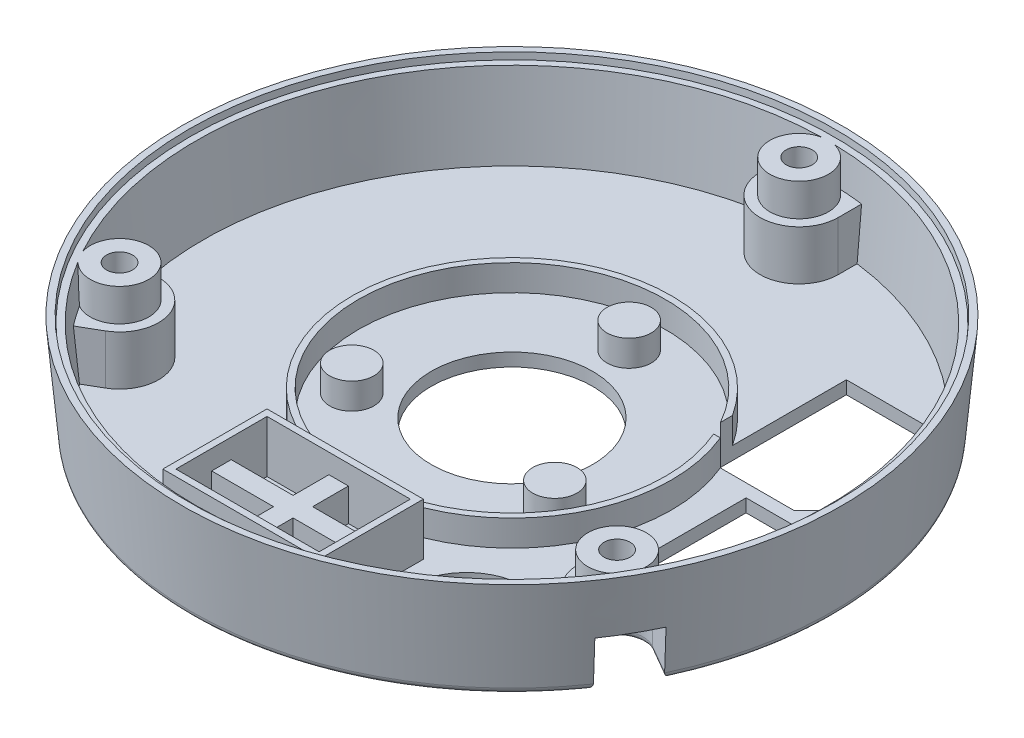
from build123d import *

# Parameters (mm, degrees)
SKETCH_8_R               = 2.25
EXTRUDE_23_DEPTH         = 6.3
EXTRUDE_24_DEPTH         = 3.8
SKETCH_8_5_R             = 1
CUT_EXTRUDE_2_DEPTH      = 37.420049423
PATTERN_CIRCULAR_1_COUNT = 3
CUT_EXTRUDE_3_DEPTH      = 3.7
PATTERN_CIRCULAR_2_COUNT = 3
CUT_EXTRUDE_6_DEPTH      = 1
SKETCH_12_W              = 12
SKETCH_12_H              = 8
SKETCH_12_W_2            = 11
SKETCH_12_H_2            = 7
EXTRUDE_1_DEPTH          = 4
SKETCH_14_R              = 6.2
SKETCH_14_R_2            = 4.5
CUT_EXTRUDE_7_DEPTH      = 1
FILLET_1_R               = 0.5
EXTRUDE_25_DEPTH         = 2.5
EXTRUDE_26_OUTLINE_R     = 1.7
EXTRUDE_26_DEPTH         = 2


# Read off the part's stored shape, not the designer's step: 凸台-拉伸26
with BuildPart() as part:
    # 草图7 → 旋转1 (revolve)
    with BuildSketch(Plane.XY, mode=Mode.PRIVATE) as revolve_1_sk:
        Polygon((0, 0), (24.6, 0), (25.3, 7.8), (24.8, 7.8), (24.755128205, 7.3), (24.255128205, 7.3), (23.68974359, 1), (0, 1), align=None)
    revolve(revolve_1_sk.sketch.rotate(Axis((0, 1, 0), (0, -1, 0)), 180), axis=Axis((0, 1, 0), (0, -1, 0)))

    # 草图8 → 凸台-拉伸23 (add)
    with BuildSketch(Plane(origin=(0, 1, 0), x_dir=(1, 0, 0), z_dir=(0, 1, 0))):
        with Locations((0, 22.05)):
            Circle(SKETCH_8_R)
    extrude_23 = extrude(amount=EXTRUDE_23_DEPTH)

    # 草图8<4> → 凸台-拉伸24 (add)
    with BuildSketch(Plane(origin=(0, 1, 0), x_dir=(1, 0, 0), z_dir=(0, 1, 0))):
        with BuildLine():
            Line((-3, 22.05), (-3, 24.114103757))
            ThreePointArc((-3, 24.114103757), (0, 24.3), (3, 24.114103757))
            Line((3, 24.114103757), (3, 22.05))
            ThreePointArc((3, 22.05), (0, 19.05), (-3, 22.05))
        make_face()
    extrude_24 = extrude(amount=EXTRUDE_24_DEPTH)

    # 草图8<5> → 切除-拉伸2 (cut, symmetric)
    with BuildSketch(Plane(origin=(0, 1, 0), x_dir=(1, 0, 0), z_dir=(0, 1, 0))):
        with Locations(Location((0, 22.05, 0), (0, 0, 180))):
            Circle(SKETCH_8_5_R)
    cut_extrude_2 = extrude(amount=CUT_EXTRUDE_2_DEPTH, both=True, mode=Mode.SUBTRACT)

    # 阵列(圆周)1: 凸台-拉伸23, 凸台-拉伸24, 切除-拉伸2 ×3 about axis
    pattern_circular_1_axis = Axis((0, 0, 0), (0, 1, 0))
    add([extrude_23.rotate(pattern_circular_1_axis, i * 360 / PATTERN_CIRCULAR_1_COUNT) for i in range(1, PATTERN_CIRCULAR_1_COUNT)])
    add([extrude_24.rotate(pattern_circular_1_axis, i * 360 / PATTERN_CIRCULAR_1_COUNT) for i in range(1, PATTERN_CIRCULAR_1_COUNT)])
    add([cut_extrude_2.rotate(pattern_circular_1_axis, i * 360 / PATTERN_CIRCULAR_1_COUNT) for i in range(1, PATTERN_CIRCULAR_1_COUNT)], mode=Mode.SUBTRACT)

    # 草图9 → 切除-拉伸3 (cut)
    with BuildSketch(Plane.XZ):
        with BuildLine():
            Line((2, -22.05), (2, -26.095171051))
            Line((2, -26.095171051), (-2, -26.095171051))
            Line((-2, -26.095171051), (-2, -22.05))
            ThreePointArc((-2, -22.05), (0, -20.05), (2, -22.05))
        make_face()
    cut_extrude_3 = extrude(amount=-CUT_EXTRUDE_3_DEPTH, mode=Mode.SUBTRACT)

    # 阵列(圆周)2: 切除-拉伸3 ×3 about axis
    pattern_circular_2_axis = Axis((0, 0, 0), (0, 1, 0))
    for i in range(1, PATTERN_CIRCULAR_2_COUNT):
        add(cut_extrude_3.rotate(pattern_circular_2_axis, i * 360 / PATTERN_CIRCULAR_2_COUNT), mode=Mode.SUBTRACT)

    # 草图11 → 切除-拉伸6 (cut)
    with BuildSketch(Plane(origin=(0, 1, 0), x_dir=(1, 0, 0), z_dir=(0, 1, 0))):
        Polygon((10.3, 15.375), (10.3, 4.675), (17, 4.675), (19, 6.675), (19, 13.375), (17, 15.375), align=None)
        Polygon((14.3, 3.675), (14.3, -7.025), (21, -7.025), (23, -5.025), (23, 1.675), (21, 3.675), align=None)
    extrude(amount=-CUT_EXTRUDE_6_DEPTH, mode=Mode.SUBTRACT)

    # 草图12 → 拉伸-薄壁1 (add)
    with BuildSketch(Plane(origin=(0, 1, 0), x_dir=(1, 0, 0), z_dir=(0, 1, 0))):
        with Locations((0, -16.8)):
            Rectangle(SKETCH_12_W, SKETCH_12_H)
        with Locations((0, -16.8)):
            Rectangle(SKETCH_12_W_2, SKETCH_12_H_2, mode=Mode.SUBTRACT)
    extrude(amount=EXTRUDE_1_DEPTH)

    # 草图14 → 切除-拉伸7 (cut)
    with BuildSketch(Plane(origin=(0, 1, 0), x_dir=(1, 0, 0), z_dir=(0, 1, 0))):
        with Locations(Location((0, 0, 0), (0, 0, 180))):
            Circle(SKETCH_14_R)
        with Locations(Location((11.70765428, -15.20450888, 0), (0, 0, 180))):
            Circle(SKETCH_14_R_2)
    extrude(amount=-CUT_EXTRUDE_7_DEPTH, mode=Mode.SUBTRACT)

    # 圆角1
    fillet_1_edges = [part.edges().sort_by_distance(p)[0] for p in [
        (17.363809346, 0, 10.025),
        (21.164779892, 0, 9.910090291),
        (-21.164779892, 0, 9.910090291),
        (-17.363809346, 0, 10.025),
        (-19.164779892, 0, 13.374191906),
        (-18.088117647, 0, -16.67273223),
        (-2, 0, -23.284282198),
        (0, 0, -20.05),
        (2, 0, -23.284282198),
        (21.304224933, 0, -12.3),
        (19.164779892, 0, 13.374191906),
        (0, 0, 24.6),
    ]]
    fillet(fillet_1_edges, radius=FILLET_1_R)

    # 草图15 → 凸台-拉伸25 (add)
    with BuildSketch(Plane(origin=(0, 1, 0), x_dir=(1, 0, 0), z_dir=(0, 1, 0))):
        Polygon((0.75, -17.55), (5.5, -17.55), (5.5, -16.05), (0.75, -16.05), (0.75, -13.3), (-0.75, -13.3), (-0.75, -16.05), (-5.5, -16.05), (-5.5, -17.55), (-0.75, -17.55), (-0.75, -20.3), (0.75, -20.3), align=None)
    extrude(amount=EXTRUDE_25_DEPTH)

    # 凸台-拉伸26 outline → 凸台-拉伸26 (add)
    with BuildSketch(Plane(origin=(0, 1, 0), x_dir=(1, 0, 0), z_dir=(0, 1, 0))):
        with BuildLine():
            Line((11.322847478, 4.675), (10.807173544, 4.675))
            ThreePointArc((10.807173544, 4.675), (-10.566173989, -5.196786722), (10.3, 5.706191812))
            Line((10.3, 5.706191812), (10.3, 6.631176366))
            ThreePointArc((10.3, 6.631176366), (-10.855576433, -5.676174795), (11.322847478, 4.675))
        make_face()
        with Locations((0, 9)):
            Circle(EXTRUDE_26_OUTLINE_R)
        with Locations((7.794228634, -4.5)):
            Circle(EXTRUDE_26_OUTLINE_R)
        with Locations((-7.794228634, -4.5)):
            Circle(EXTRUDE_26_OUTLINE_R)
    extrude(amount=EXTRUDE_26_DEPTH)


solid = part.part
